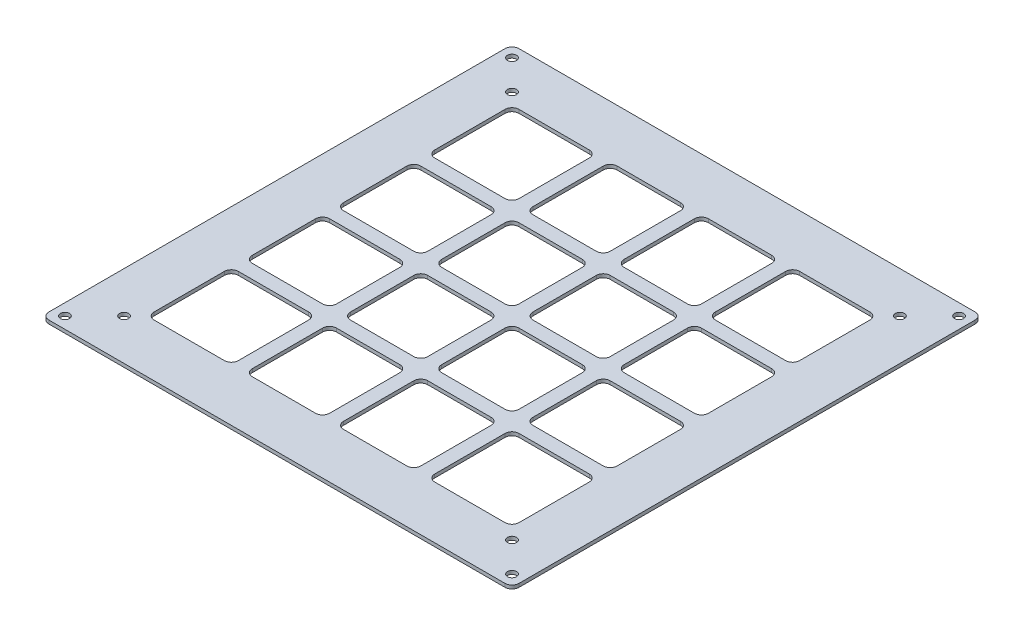
from build123d import *

# Parameters (mm, degrees)
SKETCH1_W           = 214.108538
SKETCH1_H           = 214.108538
SKETCH1_R           = 2.0701
BOSS_EXTRUDE1_DEPTH = 1.5875
SKETCH2_W           = 38.371842409
SKETCH2_H           = 38.371842409
SKETCH2_H_2         = 35.196842409
SKETCH2_W_2         = 35.196842409
CUT_EXTRUDE1_DEPTH  = 152.405921874
FILLET1_R           = 3.175
FILLET2_R           = 3.175


with BuildPart() as part:
    # Sketch1 → Boss-Extrude1 (new body)
    with BuildSketch(Plane(origin=(0, 0, 0), x_dir=(1, 0, 0), z_dir=(0, 1, 0))):
        Rectangle(SKETCH1_W, SKETCH1_H)
        with Locations((-101.809169, 101.809169)):
            Circle(SKETCH1_R, mode=Mode.SUBTRACT)
        with Locations((-101.809169, -101.809169)):
            Circle(SKETCH1_R, mode=Mode.SUBTRACT)
        with Locations((101.809169, -101.809169)):
            Circle(SKETCH1_R, mode=Mode.SUBTRACT)
        with Locations((101.809169, 101.809169)):
            Circle(SKETCH1_R, mode=Mode.SUBTRACT)
        with Locations((-88.338784818, 88.338784818)):
            Circle(SKETCH1_R, mode=Mode.SUBTRACT)
        with Locations((88.338784818, -88.338784818)):
            Circle(SKETCH1_R, mode=Mode.SUBTRACT)
        with Locations((88.338784818, 88.338784818)):
            Circle(SKETCH1_R, mode=Mode.SUBTRACT)
        with Locations((-88.338784818, -88.338784818)):
            Circle(SKETCH1_R, mode=Mode.SUBTRACT)
    extrude(amount=BOSS_EXTRUDE1_DEPTH)

    # Sketch2 → Cut-Extrude1 (cut, through all)
    with BuildSketch(Plane(origin=(0, 1.5875, 0), x_dir=(1, 0, 0), z_dir=(0, 1, 0))):
        with Locations((-63.907763614, 63.907763614)):
            Rectangle(SKETCH2_W, SKETCH2_H)
        with Locations((-63.907763614, 20.773421204)):
            Rectangle(SKETCH2_W, SKETCH2_H_2)
        with Locations((-20.773421204, 63.907763614)):
            Rectangle(SKETCH2_W_2, SKETCH2_H)
        with Locations((-63.907763614, -20.773421204)):
            Rectangle(SKETCH2_W, SKETCH2_H_2)
        with Locations((-20.773421204, 20.773421204)):
            Rectangle(SKETCH2_W_2, SKETCH2_H_2)
        with Locations((20.773421204, 63.907763614)):
            Rectangle(SKETCH2_W_2, SKETCH2_H)
        with Locations((-63.907763614, -63.907763614)):
            Rectangle(SKETCH2_W, SKETCH2_H)
        with Locations((-20.773421204, -20.773421204)):
            Rectangle(SKETCH2_W_2, SKETCH2_H_2)
        with Locations((20.773421204, 20.773421204)):
            Rectangle(SKETCH2_W_2, SKETCH2_H_2)
        with Locations((63.907763614, 63.907763614)):
            Rectangle(SKETCH2_W, SKETCH2_H)
        with Locations((-20.773421204, -63.907763614)):
            Rectangle(SKETCH2_W_2, SKETCH2_H)
        with Locations((20.773421204, -20.773421204)):
            Rectangle(SKETCH2_W_2, SKETCH2_H_2)
        with Locations((63.907763614, 20.773421204)):
            Rectangle(SKETCH2_W, SKETCH2_H_2)
        with Locations((20.773421204, -63.907763614)):
            Rectangle(SKETCH2_W_2, SKETCH2_H)
        with Locations((63.907763614, -20.773421204)):
            Rectangle(SKETCH2_W, SKETCH2_H_2)
        with Locations((63.907763614, -63.907763614)):
            Rectangle(SKETCH2_W, SKETCH2_H)
    extrude(amount=-CUT_EXTRUDE1_DEPTH, mode=Mode.SUBTRACT)

    # Fillet1
    fillet1_edges = [part.edges().sort_by_distance(p)[0] for p in [
        (-107.054269, 0.79375, 107.054269),
        (107.054269, 0.79375, 107.054269),
        (107.054269, 0.79375, -107.054269),
        (-107.054269, 0.79375, -107.054269),
    ]]
    fillet(fillet1_edges, radius=FILLET1_R)

    # Fillet2
    fillet2_edges = [part.edges().sort_by_distance(p)[0] for p in [
        (-38.371842409, 0.79375, -44.721842409),
        (-38.371842409, 0.79375, -83.093684818),
        (-3.175, 0.79375, -83.093684818),
        (-3.175, 0.79375, -44.721842409),
        (-38.371842409, 0.79375, -3.175),
        (-38.371842409, 0.79375, -38.371842409),
        (-3.175, 0.79375, -38.371842409),
        (-3.175, 0.79375, -3.175),
        (3.175, 0.79375, -83.093684818),
        (38.371842409, 0.79375, -83.093684818),
        (38.371842409, 0.79375, -44.721842409),
        (3.175, 0.79375, -44.721842409),
        (83.093684818, 0.79375, -83.093684818),
        (83.093684818, 0.79375, -44.721842409),
        (44.721842409, 0.79375, -44.721842409),
        (44.721842409, 0.79375, -83.093684818),
        (44.721842409, 0.79375, -3.175),
        (44.721842409, 0.79375, -38.371842409),
        (83.093684818, 0.79375, -38.371842409),
        (83.093684818, 0.79375, -3.175),
        (83.093684818, 0.79375, 3.175),
        (83.093684818, 0.79375, 38.371842409),
        (44.721842409, 0.79375, 38.371842409),
        (44.721842409, 0.79375, 3.175),
        (3.175, 0.79375, 3.175),
        (38.371842409, 0.79375, 3.175),
        (38.371842409, 0.79375, 38.371842409),
        (3.175, 0.79375, 38.371842409),
        (-38.371842409, 0.79375, 38.371842409),
        (-38.371842409, 0.79375, 3.175),
        (-3.175, 0.79375, 3.175),
        (-3.175, 0.79375, 38.371842409),
        (-83.093684818, 0.79375, 3.175),
        (-44.721842409, 0.79375, 3.175),
        (-44.721842409, 0.79375, 38.371842409),
        (-83.093684818, 0.79375, 38.371842409),
        (-38.371842409, 0.79375, 83.093684818),
        (-38.371842409, 0.79375, 44.721842409),
        (-3.175, 0.79375, 44.721842409),
        (-3.175, 0.79375, 83.093684818),
        (3.175, 0.79375, 44.721842409),
        (38.371842409, 0.79375, 44.721842409),
        (38.371842409, 0.79375, 83.093684818),
        (3.175, 0.79375, 83.093684818),
        (44.721842409, 0.79375, 83.093684818),
        (44.721842409, 0.79375, 44.721842409),
        (83.093684818, 0.79375, 44.721842409),
        (83.093684818, 0.79375, 83.093684818),
        (-83.093684818, 0.79375, -83.093684818),
        (-44.721842409, 0.79375, -83.093684818),
        (-44.721842409, 0.79375, -44.721842409),
        (-83.093684818, 0.79375, -44.721842409),
        (-44.721842409, 0.79375, 83.093684818),
        (-83.093684818, 0.79375, 44.721842409),
        (-44.721842409, 0.79375, 44.721842409),
        (3.175, 0.79375, -3.175),
        (3.175, 0.79375, -38.371842409),
        (38.371842409, 0.79375, -38.371842409),
        (38.371842409, 0.79375, -3.175),
        (-44.721842409, 0.79375, -3.175),
        (-83.093684818, 0.79375, -3.175),
        (-83.093684818, 0.79375, -38.371842409),
        (-44.721842409, 0.79375, -38.371842409),
        (-83.093684818, 0.79375, 83.093684818),
    ]]
    fillet(fillet2_edges, radius=FILLET2_R)


solid = part.part
